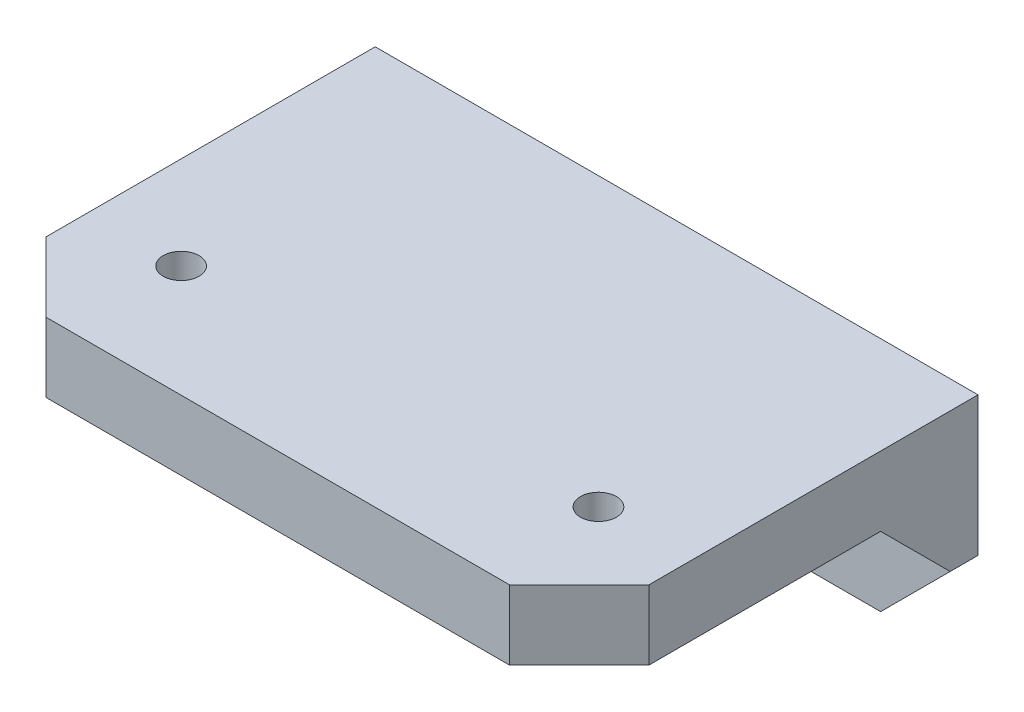
from build123d import *

# Parameters (mm, degrees)
BOSS_EXTRUDE1_DEPTH   = 6.35
SKETCH2_W             = 82.55
SKETCH2_H             = 9.525
BOSS_EXTRUDE2_DEPTH   = 50.8
CHAMFER1_SIZE         = 9.525
F_8_CLEARANCE_HOLE1_D = 4.9149
CUT_EXTRUDE1_REACH    = 223.791
SKETCH5_R             = 6.35
F_8_CLEARANCE_HOLE2_D = 4.9149
CHAMFER2_SIZE         = 2.54


with BuildPart() as part:
    # Sketch1 → Boss-Extrude1 (new body)
    with BuildSketch(Plane.XY):
        Polygon((-151.095016336, -53.975), (-126.488766336, -53.975), (-126.488766336, -25.4), (-209.038766336, -25.4), (-209.038766336, -53.975), align=None)
    extrude(amount=BOSS_EXTRUDE1_DEPTH)

    # Sketch2 → Boss-Extrude2 (add)
    with BuildSketch(Plane.XY.offset(6.35)):
        with Locations((-167.763766336, -30.1625)):
            Rectangle(SKETCH2_W, SKETCH2_H)
    extrude(amount=BOSS_EXTRUDE2_DEPTH)

    # Chamfer1
    chamfer1_edges = [part.edges().sort_by_distance(p)[0] for p in [
        (-167.763766336, -34.925, 6.35),
        (-126.488766336, -53.975, 3.175),
        (-126.488766336, -30.1625, 57.15),
        (-209.038766336, -30.1625, 57.15),
        (-209.038766336, -53.975, 3.175),
    ]]
    chamfer(chamfer1_edges, length=CHAMFER1_SIZE - 0.0001)  # a hair under: the kernel refuses the full size

    # #8 Clearance Hole1 (through all)
    with Locations(Plane.XY.offset(57.15)):
        with Locations((-193.163766336, -44.45), (-142.363766336, -44.45)):
            Hole(F_8_CLEARANCE_HOLE1_D / 2)

    # Sketch5 → Cut-Extrude1 (cut, up to next)
    with BuildSketch(Plane.XY.offset(6.35), mode=Mode.PRIVATE) as cut_extrude1_sk1:
        with Locations((-193.163766336, -44.45)):
            Circle(SKETCH5_R)
    cut_extrude1_tool1 = extrude(cut_extrude1_sk1.sketch, amount=CUT_EXTRUDE1_REACH, mode=Mode.PRIVATE) & part.part
    # Sketch5 → Cut-Extrude1 (cut, up to next)
    with BuildSketch(Plane.XY.offset(6.35), mode=Mode.PRIVATE) as cut_extrude1_sk2:
        with Locations((-142.363766336, -44.45)):
            Circle(SKETCH5_R)
    cut_extrude1_tool2 = extrude(cut_extrude1_sk2.sketch, amount=CUT_EXTRUDE1_REACH, mode=Mode.PRIVATE) & part.part
    add(cut_extrude1_tool1.solids().sort_by_distance((-193.163766, -44.45, 6.35))[0], mode=Mode.SUBTRACT)
    add(cut_extrude1_tool2.solids().sort_by_distance((-142.363766, -44.45, 6.35))[0], mode=Mode.SUBTRACT)

    # #8 Clearance Hole2 (through all)
    with Locations(Plane(origin=(0, -34.925, 0), x_dir=(-1, 0, 0), z_dir=(0, -1, 0))):
        with Locations((196.338766336, -41.818328597), (139.188766336, -41.818328597)):
            Hole(F_8_CLEARANCE_HOLE2_D / 2)

    # Chamfer2
    chamfer2_edges = [part.edges().sort_by_distance(p)[0] for p in [
        (-126.488766336, -34.92505, 0),
        (-167.763766336, -53.975, 0),
        (-204.276316336, -49.21255, 0),
        (-131.251216336, -49.21255, 0),
        (-209.038766336, -34.92505, 0),
        (-167.763766336, -25.4, 0),
    ]]
    chamfer(chamfer2_edges, length=CHAMFER2_SIZE)


solid = part.part
